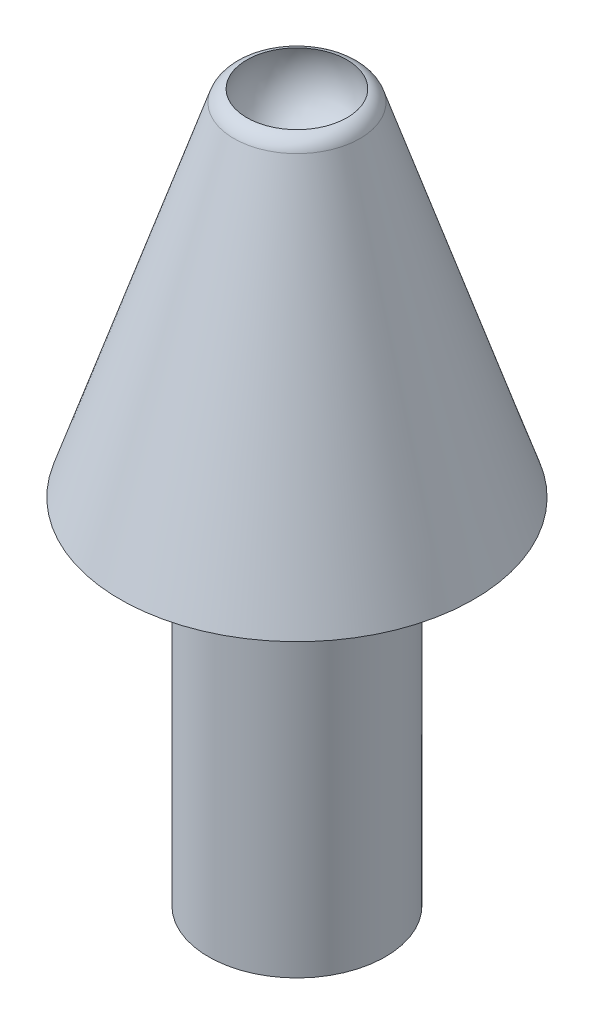
from build123d import *

# Parameters (mm, degrees)
REDONDEO1_R = 0.1


with BuildPart() as part:
    # Croquis1 → Revolución1 (revolve)
    with BuildSketch(Plane.XY, mode=Mode.PRIVATE) as revoluci_n1_sk:
        with BuildLine():
            Line((0.39999999999987756, -1.4200968373354317), (0.39999999999987756, 0.6799031626646908))
            Line((0.39999999999987756, 0.6799031626646908), (0.09999999999987759, 0.6799031626646908))
            Line((0.09999999999987759, 0.6799031626646908), (0.09999999999987759, 2.1985465652935696))
            ThreePointArc((0.09999999999987759, 2.1985465652935696), (0.2703704027459185, 2.3513898726964784), (0.28336374941518433, 2.5799031626645688))
            Line((0.28336374941518433, 2.5799031626645688), (0.33419321065036695, 2.5799031626645688))
            Line((0.33419321065036695, 2.5799031626645688), (1, 0.5799031626645683))
            Line((1, 0.5799031626645683), (0.5, 0.5799031626645683))
            Line((0.5, 0.5799031626645683), (0.5, -1.4200968373354317))
            Line((0.5, -1.4200968373354317), (0.39999999999987756, -1.4200968373354317))
        make_face()
    revolve(revoluci_n1_sk.sketch.rotate(Axis((0, -1000, 0), (0, 1, 0)), 90), axis=Axis((0, -1000, 0), (0, 1, 0)))

    # Redondeo1
    # the kernel refuses this fillet: 0.1 mm, written as the material it takes off along each edge
    with BuildSketch(Plane(origin=(0, 2.57990316266455, 0), x_dir=(1.1e-16, 0, -1), z_dir=(1, 0, 1.1e-16))) as redondeo1_piece_1:
        with BuildLine():
            CenterArc((0.26126482017864594, -0.09752762340280041), REDONDEO1_R, 18.412775660574653, 58.82007881001293)
            Line((0.28336374941518433, 0), (0.2838057279999151, 0.00195055246805609))
            ThreePointArc((0.2838057279999151, 0.00195055246805609), (0.30877848003277564, 0.00199999999999978), (0.33419321065036695, 0.00199999999999978))
            Line((0.33419321065036695, 0.00199999999999978), (0.33609082186131406, 0.00063172121389732))
            Line((0.33609082186131406, 0.00063172121389732), (0.3580429919369484, -0.06530984149403896))
            Line((0.3580429919369484, -0.06530984149403896), (0.35614538072600127, -0.06594156270793627))
        make_face()
    revolve(axis=Axis((0, 2.57990316266455, 0), (0, 1, 0)), mode=Mode.SUBTRACT)


solid = part.part
